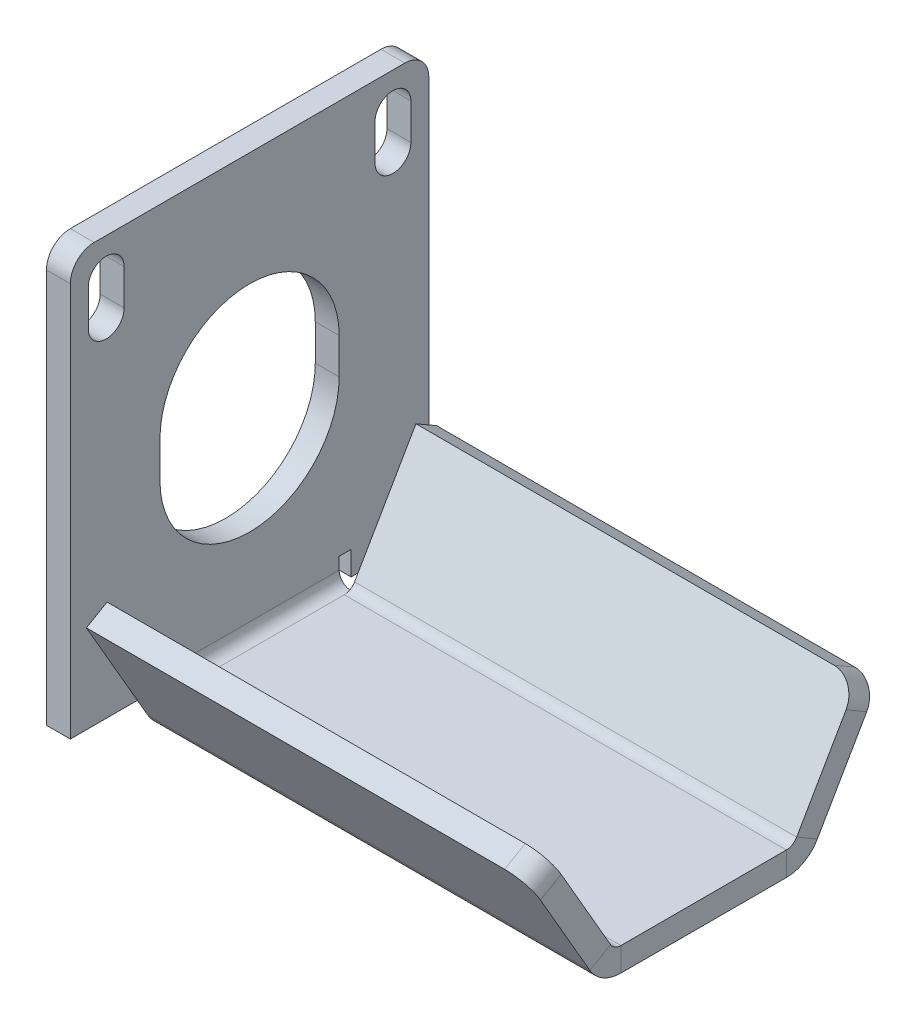
from build123d import *

# Parameters (mm, degrees)
SKETCH1_W                      = 30
SKETCH1_H                      = 35
BASE_FLANGE1_DEPTH             = 2
EDGE_FLANGE1_STRIP_W           = 10
EDGE_FLANGE1_STRIP_H           = 2
EDGE_FLANGE1_STRIP_CUT_DEPTH   = 15
EDGE_FLANGE1_RELIEF_W          = 11
EDGE_FLANGE1_RELIEF_H          = 1
EDGE_FLANGE1_RELIEF_CUT_DEPTH  = 2
EDGE_FLANGE1_DEPTH             = 15
CUT_EXTRUDE1_REACH             = 1222.389
CUT_EXTRUDE2_REACH             = 1222.389
EDGE_FLANGE3_STRIP_CUT_DEPTH   = 37
EDGE_FLANGE3_STRIP_CUT_2_DEPTH = 37
EDGE_FLANGE3_DEPTH             = 37
EDGE_FLANGE3_BEND_DEPTH        = 37
FILLET5_R                      = 2


# Sheet-metal steps are written as plain solids
with BuildPart() as part:
    # Sketch1 → Base-Flange1 (new body)
    with BuildSketch(Plane(origin=(23.590386714, 0, 0), x_dir=(0, 0, -1), z_dir=(1, 0, 0))):
        with Locations((0.307827961, 1202.201275355)):
            Rectangle(SKETCH1_W, SKETCH1_H)
    extrude(amount=BASE_FLANGE1_DEPTH)

    # Edge-Flange1 strip (across the edge) → Edge-Flange1 strip cut (cut)
    with BuildSketch(Plane(origin=(25.590386714, 1184.701275355, 7.192172039), x_dir=(0, 1, 0), z_dir=(0, 0, -1))):
        with Locations((-4, -1)):
            Rectangle(EDGE_FLANGE1_STRIP_W, EDGE_FLANGE1_STRIP_H)
    extrude(amount=EDGE_FLANGE1_STRIP_CUT_DEPTH, mode=Mode.SUBTRACT)

    # Edge-Flange1 relief (on the sheet) → Edge-Flange1 relief cut (cut)
    with BuildSketch(Plane(origin=(25.590386714, 1185.701275355, 7.192172039), x_dir=(0, 1, 0), z_dir=(1, 0, 0))):
        with Locations((-4.5, 0.5)):
            Rectangle(EDGE_FLANGE1_RELIEF_W, EDGE_FLANGE1_RELIEF_H)
        with Locations((-4.5, -15.5)):
            Rectangle(EDGE_FLANGE1_RELIEF_W, EDGE_FLANGE1_RELIEF_H)
    extrude(amount=-EDGE_FLANGE1_RELIEF_CUT_DEPTH, mode=Mode.SUBTRACT)

    # Edge-Flange1 section (across the edge) → Edge-Flange1 (add)
    with BuildSketch(Plane(origin=(25.590386714, 1184.701275355, 7.192172039), x_dir=(0, 1, 0), z_dir=(0, 0, -1))):
        with BuildLine():
            Line((-2, 1), (-2, 38))
            Line((-2, 38), (0, 38))
            Line((0, 38), (0, 1))
            ThreePointArc((0, 1), (0.292893219, 0.292893219), (1, 0))
            Line((1, 0), (1, -2))
            ThreePointArc((1, -2), (-1.121320344, -1.121320344), (-2, 1))
        make_face()
    extrude(amount=EDGE_FLANGE1_DEPTH)

    # Sketch7 → Cut-Extrude1 (cut, up to next)
    with BuildSketch(Plane(origin=(25.590386714, 0, 0), x_dir=(0, 0, -1), z_dir=(1, 0, 0)), mode=Mode.PRIVATE) as cut_extrude1_sk1:
        with BuildLine():
            Line((-10.192172039, 1216.701275355), (-10.192172039, 1213.701275355))
            ThreePointArc((-10.192172039, 1213.701275355), (-11.692172039, 1212.201275355), (-13.192172039, 1213.701275355))
            Line((-13.192172039, 1213.701275355), (-13.192172039, 1216.701275355))
            ThreePointArc((-13.192172039, 1216.701275355), (-11.692172039, 1218.201275355), (-10.192172039, 1216.701275355))
        make_face()
    cut_extrude1_tool1 = extrude(cut_extrude1_sk1.sketch, amount=-CUT_EXTRUDE1_REACH, mode=Mode.PRIVATE) & part.part
    # Sketch7 → Cut-Extrude1 (cut, up to next)
    with BuildSketch(Plane(origin=(25.590386714, 0, 0), x_dir=(0, 0, -1), z_dir=(1, 0, 0)), mode=Mode.PRIVATE) as cut_extrude1_sk2:
        with BuildLine():
            Line((10.807827961, 1216.701275355), (10.807827961, 1213.701275355))
            ThreePointArc((10.807827961, 1213.701275355), (12.307827961, 1212.201275355), (13.807827961, 1213.701275355))
            Line((13.807827961, 1213.701275355), (13.807827961, 1216.701275355))
            ThreePointArc((13.807827961, 1216.701275355), (12.307827961, 1218.201275355), (10.807827961, 1216.701275355))
        make_face()
    cut_extrude1_tool2 = extrude(cut_extrude1_sk2.sketch, amount=-CUT_EXTRUDE1_REACH, mode=Mode.PRIVATE) & part.part
    add(cut_extrude1_tool1.solids().sort_by_distance((25.590387, 1215.201275, 11.692172))[0], mode=Mode.SUBTRACT)
    add(cut_extrude1_tool2.solids().sort_by_distance((25.590387, 1215.201275, -12.307828))[0], mode=Mode.SUBTRACT)

    # Sketch8 → Cut-Extrude2 (cut, up to next)
    with BuildSketch(Plane(origin=(25.590386714, 0, 0), x_dir=(0, 0, -1), z_dir=(1, 0, 0)), mode=Mode.PRIVATE) as cut_extrude2_sk1:
        with BuildLine():
            Line((-7.192172039, 1199.701275355), (-7.192172039, 1202.701275355))
            ThreePointArc((-7.192172039, 1202.701275355), (0.307827961, 1210.201275355), (7.807827961, 1202.701275355))
            Line((7.807827961, 1202.701275355), (7.807827961, 1199.701275355))
            ThreePointArc((7.807827961, 1199.701275355), (0.307827961, 1192.201275355), (-7.192172039, 1199.701275355))
        make_face()
    cut_extrude2_tool1 = extrude(cut_extrude2_sk1.sketch, amount=-CUT_EXTRUDE2_REACH, mode=Mode.PRIVATE) & part.part
    add(cut_extrude2_tool1.solids().sort_by_distance((25.590387, 1201.201275, -0.307828))[0], mode=Mode.SUBTRACT)

    # Edge-Flange3 strip (across the edge) → Edge-Flange3 strip cut (cut)
    with BuildSketch(Plane(origin=(26.590386714, 1184.701275355, 7.192172039), x_dir=(3.000602769257188e-15, 0.5000000000000041, -0.8660254037844364), z_dir=(1, 0, 0))):
        Polygon((-9.160254038, 2.979274058), (-0.5, -2.020725942), (0.5, -0.288675135), (-8.160254038, 4.711324865), align=None)
    extrude(amount=EDGE_FLANGE3_STRIP_CUT_DEPTH, mode=Mode.SUBTRACT)

    # Edge-Flange3 strip 2 (across the edge) → Edge-Flange3 strip cut 2 (cut)
    with BuildSketch(Plane(origin=(63.590386714, 1184.701275355, -7.807827961), x_dir=(2.9396981233624387e-15, 0.5000000000000041, 0.8660254037844364), z_dir=(-1, 0, 0))):
        Polygon((-9.160254038, 2.979274058), (-0.5, -2.020725942), (0.5, -0.288675135), (-8.160254038, 4.711324865), align=None)
    extrude(amount=EDGE_FLANGE3_STRIP_CUT_2_DEPTH, mode=Mode.SUBTRACT)

    # Edge-Flange3 section (across the edge) → Edge-Flange3 (add)
    with BuildSketch(Plane(origin=(26.590386714, 1184.701275355, 7.192172039), x_dir=(3.000602769257188e-15, 0.5000000000000041, -0.8660254037844364), z_dir=(1, 0, 0))):
        with BuildLine():
            Line((-2, 0.577350269), (-2, 10.845299462))
            Line((-2, 10.845299462), (0, 10.845299462))
            Line((0, 10.845299462), (0, 0.577350269))
            ThreePointArc((0, 0.577350269), (0.133974596, 0.077350269), (0.5, -0.288675135))
            Line((0.5, -0.288675135), (-0.5, -2.020725942))
            ThreePointArc((-0.5, -2.020725942), (-1.598076211, -0.922649731), (-2, 0.577350269))
        make_face()
    extrude(amount=EDGE_FLANGE3_DEPTH)

    # Edge-Flange3 section 2 (across the edge) → Edge-Flange3 bend (add)
    with BuildSketch(Plane(origin=(63.590386714, 1184.701275355, -7.807827961), x_dir=(2.9396981233624387e-15, 0.5000000000000041, 0.8660254037844364), z_dir=(-1, 0, 0))):
        with BuildLine():
            Line((-2, 0.577350269), (-2, 10.845299462))
            Line((-2, 10.845299462), (0, 10.845299462))
            Line((0, 10.845299462), (0, 0.577350269))
            ThreePointArc((0, 0.577350269), (0.133974596, 0.077350269), (0.5, -0.288675135))
            Line((0.5, -0.288675135), (-0.5, -2.020725942))
            ThreePointArc((-0.5, -2.020725942), (-1.598076211, -0.922649731), (-2, 0.577350269))
        make_face()
    extrude(amount=EDGE_FLANGE3_BEND_DEPTH)

    # Fillet5
    fillet5_edges = [part.edges().sort_by_distance(p)[0] for p in [
        (63.590386714, 1193.5935802, 13.480847173),
        (63.590386714, 1193.5935802, -14.096503096),
        (24.590386714, 1219.701275355, 14.692172039),
        (24.590386714, 1219.701275355, -15.307827961),
    ]]
    fillet(fillet5_edges, radius=FILLET5_R)


solid = part.part
